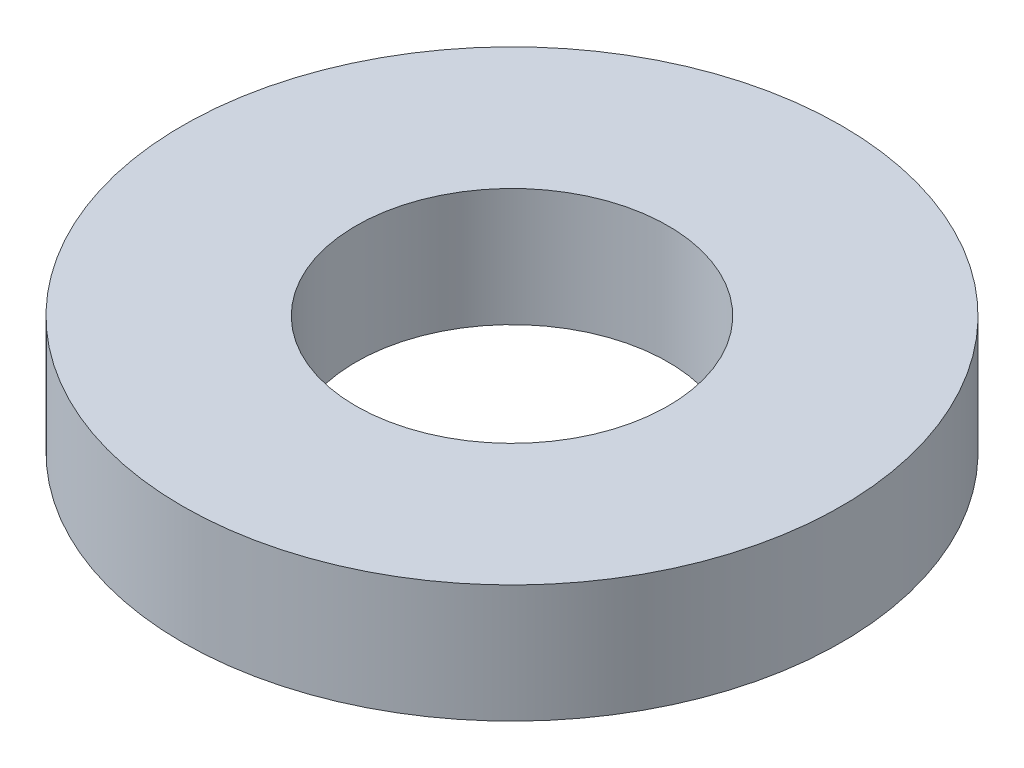
from build123d import *

# Parameters (mm, degrees)
SKETCH1_R           = 47.5
BOSS_EXTRUDE1_DEPTH = 17
SKETCH2_R           = 22.5
CUT_EXTRUDE1_DEPTH  = 70.292856775


with BuildPart() as part:
    # Sketch1 → Boss-Extrude1 (new body)
    with BuildSketch(Plane(origin=(0, 0, 0), x_dir=(1, 0, 0), z_dir=(0, 1, 0))):
        Circle(SKETCH1_R)
    extrude(amount=BOSS_EXTRUDE1_DEPTH)

    # Sketch2 → Cut-Extrude1 (cut, through all)
    with BuildSketch(Plane(origin=(0, 0, 0), x_dir=(1, 0, 0), z_dir=(0, 1, 0))):
        Circle(SKETCH2_R)
    extrude(amount=CUT_EXTRUDE1_DEPTH, mode=Mode.SUBTRACT)


solid = part.part
